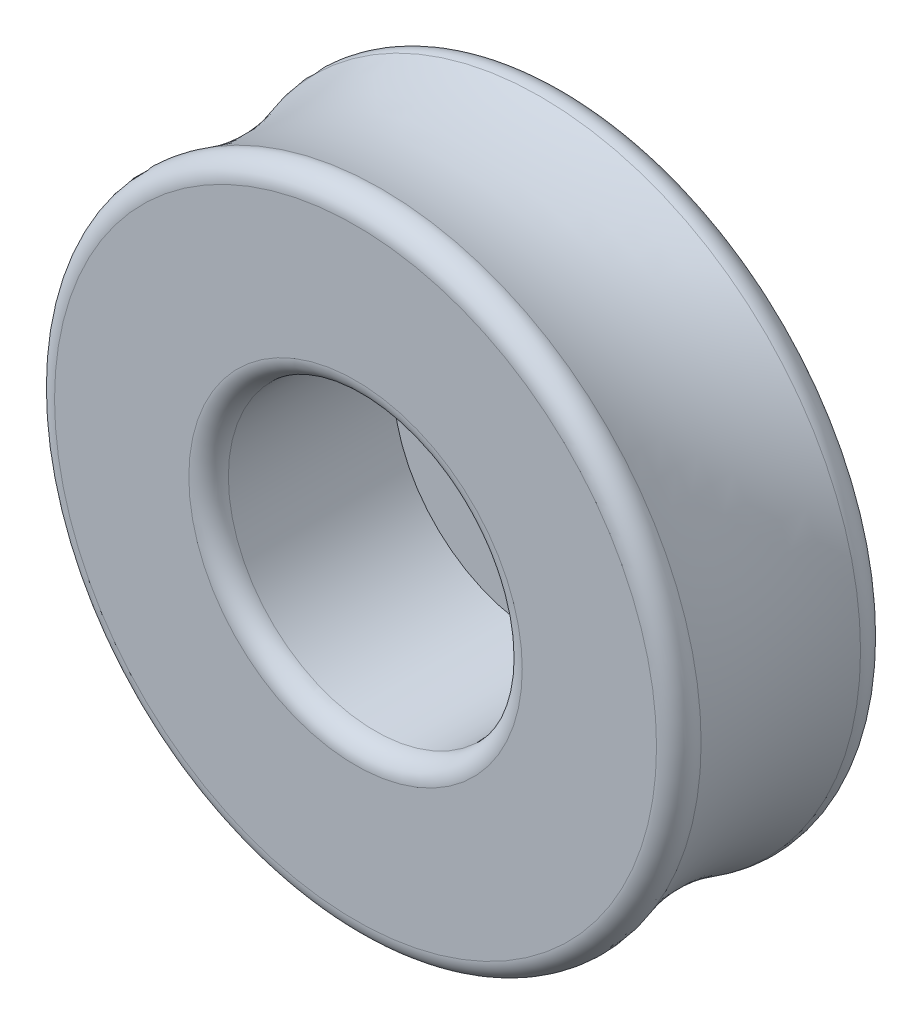
from build123d import *

# Parameters (mm, degrees)
SKETCH2_W          = 6
SKETCH2_H          = 7
SKETCH3_R          = 11.15
CUT_EXTRUDE1_DEPTH = 14
SKETCH8_R          = 4.25
CUT_EXTRUDE3_DEPTH = 48.193749586
FILLET1_R          = 1.5
FILLET2_R          = 1.5
FILLET5_R          = 1.5
FILLET6_R          = 1


with BuildPart() as part:
    # Sketch2 → Revolve1 (revolve)
    with BuildSketch(Plane(origin=(0, 0, 0), x_dir=(1, 0, 0), z_dir=(0, 1, 0)), mode=Mode.PRIVATE) as revolve1_sk:
        with BuildLine():
            Line((-12.5, 8), (12.5, 8))
            Line((12.5, 8), (12.5, -8))
            Line((12.5, -8), (-12.5, -8))
            ThreePointArc((-12.5, -8), (-10.83030278, 0), (-12.5, 8))
        make_face()
        with Locations((9.5, 11.5)):
            Rectangle(SKETCH2_W, SKETCH2_H)
        Polygon((6.5, 15), (12.5, 15), (12.5, 17), (4.5, 17), (4.5, 15), align=None)
    revolve(revolve1_sk.sketch.rotate(Axis((12.5, 0, 8), (0, 0, -1)), 180), axis=Axis((12.5, 0, 8), (0, 0, -1)))

    # Sketch3 → Cut-Extrude1 (cut)
    with BuildSketch(Plane.XY.offset(8)):
        with Locations((12.5, 0)):
            Circle(SKETCH3_R)
    extrude(amount=-CUT_EXTRUDE1_DEPTH, mode=Mode.SUBTRACT)

    # Sketch8 → Cut-Extrude3 (cut, through all)
    with BuildSketch(Plane.XY.offset(-6)):
        with Locations((12.5, 0)):
            Circle(SKETCH8_R)
    extrude(amount=-CUT_EXTRUDE3_DEPTH, mode=Mode.SUBTRACT)

    # Fillet1
    fillet1_edges = [part.edges().sort_by_distance(p)[0] for p in [
        (8.25, 0, -6),
    ]]
    fillet(fillet1_edges, radius=FILLET1_R)

    # Fillet2
    fillet2_edges = [part.edges().sort_by_distance(p)[0] for p in [
        (-12.5, 0, 8),
        (-12.5, 0, -8),
        (1.35, 0, 8),
    ]]
    fillet(fillet2_edges, radius=FILLET2_R)

    # Fillet5
    fillet5_edges = [part.edges().sort_by_distance(p)[0] for p in [
        (8.25, 0, -17),
    ]]
    fillet(fillet5_edges, radius=FILLET5_R)

    # Fillet6
    fillet6_edges = [part.edges().sort_by_distance(p)[0] for p in [
        (4.5, 0, -15),
        (4.5, 0, -17),
    ]]
    fillet(fillet6_edges, radius=FILLET6_R - 0.0001)  # a hair under: the kernel refuses the full size


solid = part.part
